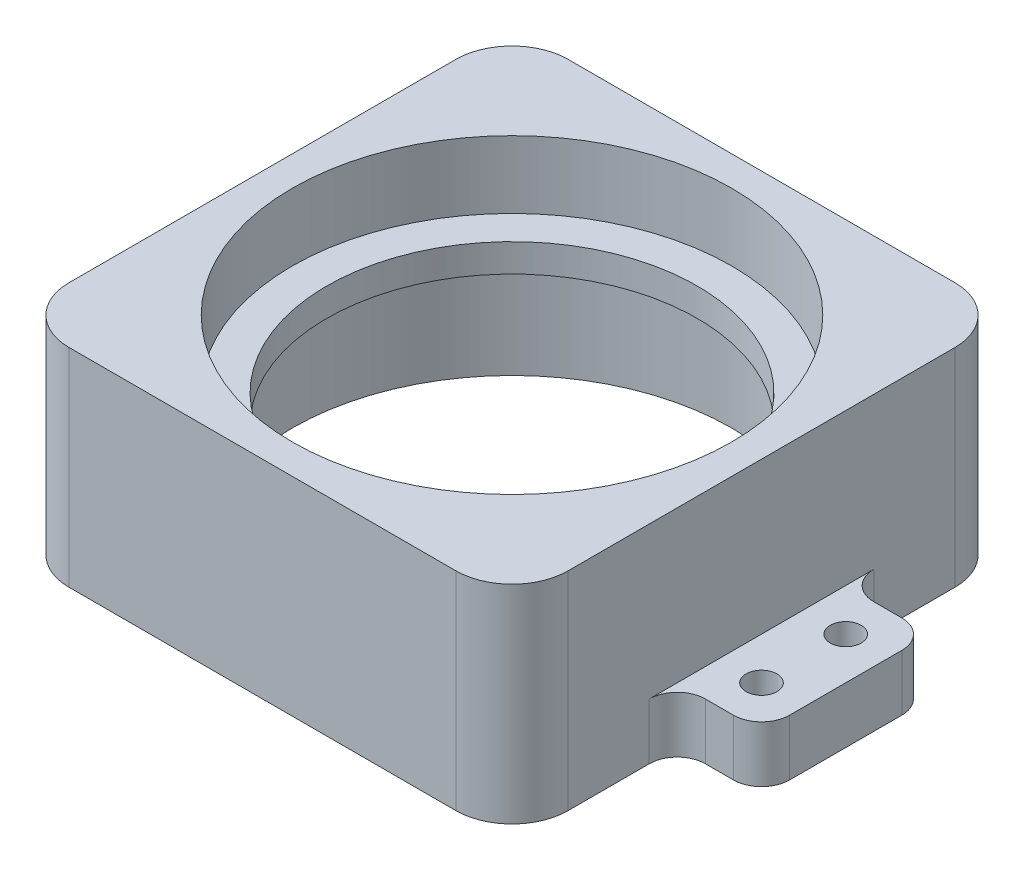
from build123d import *

# Parameters (mm, degrees)
SKETCH1_W           = 88.9
SKETCH1_H           = 88.9
SKETCH1_R           = 39.15
BOSS_EXTRUDE1_DEPTH = 20
SKETCH2_W           = 88.9
SKETCH2_H           = 88.9
SKETCH2_R           = 33
BOSS_EXTRUDE3_DEPTH = 5
SKETCH3_W           = 88.9
SKETCH3_H           = 88.9
SKETCH3_R           = 39.15
BOSS_EXTRUDE4_DEPTH = 12
SKETCH4_W           = 15
SKETCH4_H           = 30
SKETCH4_R           = 2.75
BOSS_EXTRUDE5_DEPTH = 10
FILLET1_R           = 5
FILLET2_R           = 10


with BuildPart() as part:
    # Sketch1 → Boss-Extrude1 (new body)
    with BuildSketch(Plane(origin=(0, 0, 0), x_dir=(1, 0, 0), z_dir=(0, 1, 0))):
        with Locations((44.45, 44.45)):
            Rectangle(SKETCH1_W, SKETCH1_H)
        with Locations((44.45, 44.45)):
            Circle(SKETCH1_R, mode=Mode.SUBTRACT)
    extrude(amount=BOSS_EXTRUDE1_DEPTH)

    # Sketch2 → Boss-Extrude3 (add)
    with BuildSketch(Plane(origin=(0, 20, 0), x_dir=(1, 0, 0), z_dir=(0, 1, 0))):
        with Locations((44.45, 44.45)):
            Rectangle(SKETCH2_W, SKETCH2_H)
        with Locations((44.45, 44.45)):
            Circle(SKETCH2_R, mode=Mode.SUBTRACT)
    extrude(amount=BOSS_EXTRUDE3_DEPTH)

    # Sketch3 → Boss-Extrude4 (add)
    with BuildSketch(Plane(origin=(0, 25, 0), x_dir=(1, 0, 0), z_dir=(0, 1, 0))):
        with Locations((44.45, 44.45)):
            Rectangle(SKETCH3_W, SKETCH3_H)
        with Locations((44.45, 44.45)):
            Circle(SKETCH3_R, mode=Mode.SUBTRACT)
    extrude(amount=BOSS_EXTRUDE4_DEPTH)

    # Sketch4 → Boss-Extrude5 (add)
    # profile 1 of 2: a face of its own
    with BuildSketch(Plane.XZ):
        with Locations((-7.5, -44.45)):
            Rectangle(SKETCH4_W, SKETCH4_H)
        with Locations((-7.5, -51.95)):
            Circle(SKETCH4_R, mode=Mode.SUBTRACT)
        with Locations((-7.5, -36.95)):
            Circle(SKETCH4_R, mode=Mode.SUBTRACT)
    # profile 2 of 2: a face of its own
    with BuildSketch(Plane.XZ):
        with Locations((96.4, -44.45)):
            Rectangle(SKETCH4_W, SKETCH4_H)
        with Locations((96.4, -36.95)):
            Circle(SKETCH4_R, mode=Mode.SUBTRACT)
        with Locations((96.4, -51.95)):
            Circle(SKETCH4_R, mode=Mode.SUBTRACT)
    extrude(amount=-BOSS_EXTRUDE5_DEPTH)

    # Fillet1
    fillet1_edges = [part.edges().sort_by_distance(p)[0] for p in [
        (88.9, 5, -59.45),
        (103.9, 5, -59.45),
        (103.9, 5, -29.45),
        (88.9, 5, -29.45),
        (-15, 5, -59.45),
        (0, 5, -59.45),
        (-15, 5, -29.45),
        (0, 5, -29.45),
    ]]
    fillet(fillet1_edges, radius=FILLET1_R)

    # Fillet2
    fillet2_edges = [part.edges().sort_by_distance(p)[0] for p in [
        (0, 18.5, 0),
        (88.9, 18.5, 0),
        (88.9, 18.5, -88.9),
        (0, 18.5, -88.9),
    ]]
    fillet(fillet2_edges, radius=FILLET2_R)


solid = part.part
